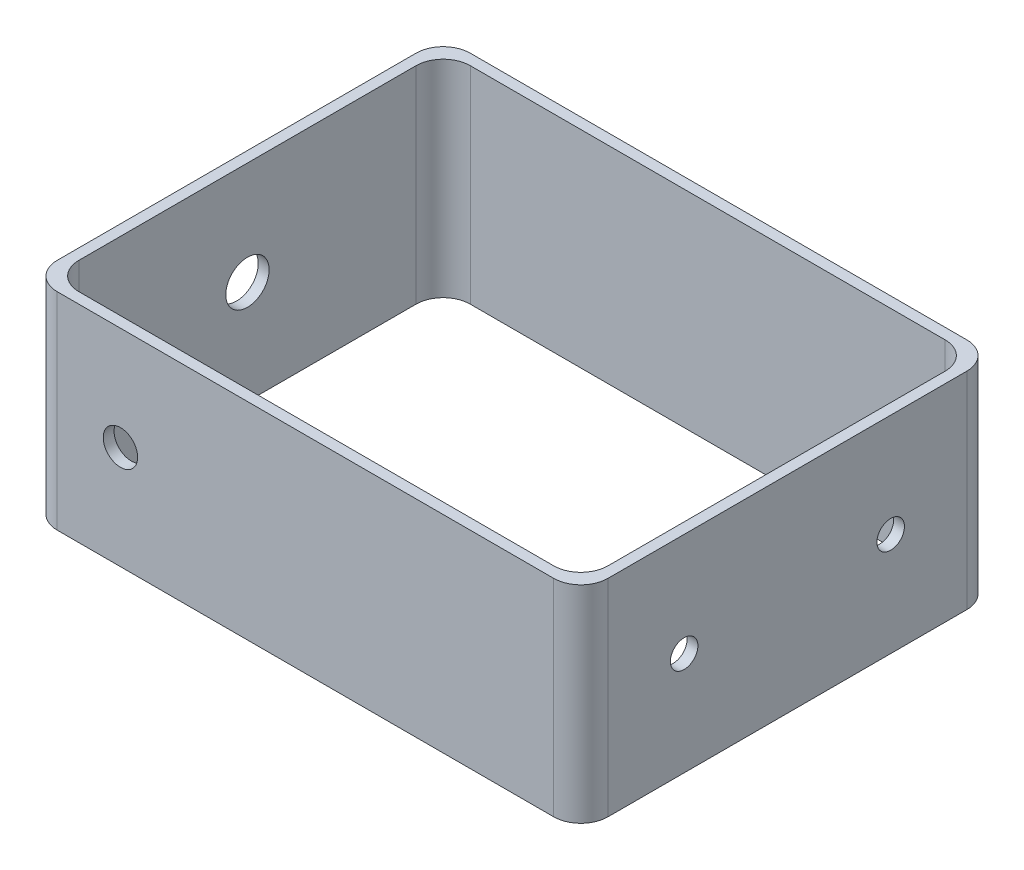
from build123d import *

# Parameters (mm, degrees)
SKETCH1_W           = 101.6
SKETCH1_H           = 76.2
BOSS_EXTRUDE1_DEPTH = 38.1
SKETCH3_W           = 97.6
SKETCH3_H           = 72.2
CUT_EXTRUDE1_DEPTH  = 75.053089065
SKETCH7_R           = 2.54
CUT_EXTRUDE2_DEPTH  = 2
SKETCH9_R           = 4
CUT_EXTRUDE3_DEPTH  = 2
SKETCH11_R          = 3.175
CUT_EXTRUDE4_DEPTH  = 2
FILLET1_R           = 5
FILLET2_R           = 5


with BuildPart() as part:
    # Sketch1 → Boss-Extrude1 (new body)
    with BuildSketch(Plane(origin=(0, 0, 0), x_dir=(1, 0, 0), z_dir=(0, 1, 0))):
        Rectangle(SKETCH1_W, SKETCH1_H)
    extrude(amount=BOSS_EXTRUDE1_DEPTH)

    # Sketch3 → Cut-Extrude1 (cut, through all)
    with BuildSketch(Plane(origin=(0, 38.1, 0), x_dir=(1, 0, 0), z_dir=(0, 1, 0))):
        Rectangle(SKETCH3_W, SKETCH3_H)
    extrude(amount=-CUT_EXTRUDE1_DEPTH, mode=Mode.SUBTRACT)

    # Sketch7 → Cut-Extrude2 (cut)
    with BuildSketch(Plane(origin=(50.8, 0, 0), x_dir=(0, 0, -1), z_dir=(1, 0, 0))):
        with Locations((-19.05, 19.05)):
            Circle(SKETCH7_R)
        with Locations((19.05, 19.05)):
            Circle(SKETCH7_R)
    extrude(amount=-CUT_EXTRUDE2_DEPTH, mode=Mode.SUBTRACT)

    # Sketch9 → Cut-Extrude3 (cut)
    with BuildSketch(Plane.ZY.offset(50.8)):
        with Locations((0, 19.05)):
            Circle(SKETCH9_R)
    extrude(amount=-CUT_EXTRUDE3_DEPTH, mode=Mode.SUBTRACT)

    # Sketch11 → Cut-Extrude4 (cut)
    with BuildSketch(Plane.XY.offset(38.1)):
        with Locations((-34.127797524, 19.05)):
            Circle(SKETCH11_R)
    extrude(amount=-CUT_EXTRUDE4_DEPTH, mode=Mode.SUBTRACT)

    # Fillet1
    fillet1_edges = [part.edges().sort_by_distance(p)[0] for p in [
        (-50.8, 19.05, 38.1),
        (-50.8, 19.05, -38.1),
        (50.8, 19.05, -38.1),
        (50.8, 19.05, 38.1),
    ]]
    fillet(fillet1_edges, radius=FILLET1_R)

    # Fillet2
    fillet2_edges = [part.edges().sort_by_distance(p)[0] for p in [
        (48.8, 19.05, -36.1),
        (48.8, 19.05, 36.1),
        (-48.8, 19.05, -36.1),
        (-48.8, 19.05, 36.1),
    ]]
    fillet(fillet2_edges, radius=FILLET2_R)


solid = part.part
